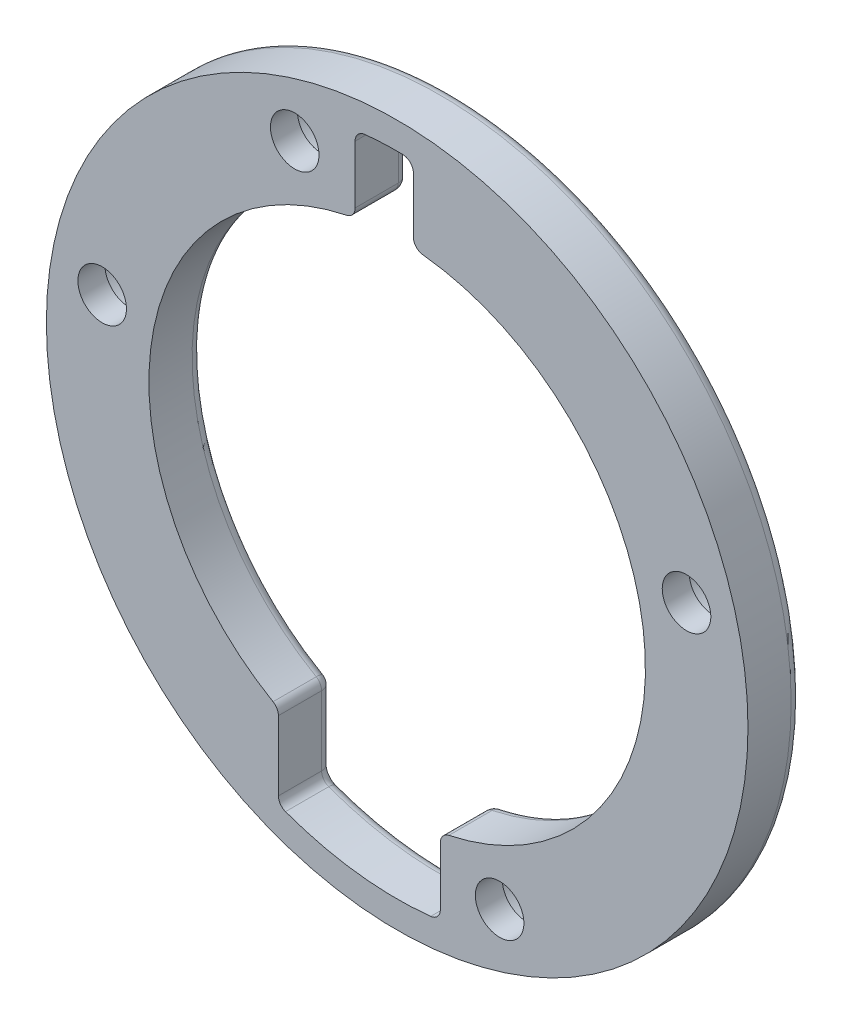
from build123d import *

# Parameters (mm, degrees)
SKETCH1_R                      = 32.5
BOSS_EXTRUDE1_DEPTH            = 5
CBORE_FOR_M4_SHCS1_D           = 4.5
CBORE_FOR_M4_SHCS1_CBORE_D     = 8.5
CBORE_FOR_M4_SHCS1_CBORE_DEPTH = 2.5
FILLET2_R                      = 1
FILLET3_R                      = 1


with BuildPart() as part:
    # Sketch1 → Boss-Extrude1 (new body)
    # profile 1 of 3: a face of its own
    with BuildSketch(Plane.XY):
        Circle(SKETCH1_R)
        with BuildLine():
            ThreePointArc((23, -5.63e-15), (17.621010186706098, -14.78174549909448), (3.9999999999999916, -22.64950330581225))
            Line((4, -22.64950330581225), (4.000000000000002, -29.732137494637012))
            ThreePointArc((4.0000000000000036, -29.73213749463701), (-3.6165626901756736, -29.781210088040908), (-11, -27.910571473905726))
            ThreePointArc((-11, -27.910571473905726), (-23.481565178581636, -18.6712639305437), (-29.671263930543617, -4.429006295324187))
            Line((-29.671263930543613, -4.429006295324186), (-22.9928556845359, -0.5732254967333699))
            ThreePointArc((-22.992855684535897, -0.5732254967333679), (-17.771682573326455, 14.600249946933266), (-3.899999999999999, 22.6669362729064))
            Line((-3.9, 22.6669362729064), (-3.9, 29.74541981549428))
            ThreePointArc((-3.8999999999999995, 29.74541981549428), (-1.204897673941924, 29.975793927689868), (1.4999999999999982, 29.96247653315726))
            ThreePointArc((1.4999999999999982, 29.96247653315726), (16.28027637225523, 25.19826583800932), (26.69826583800923, 13.682200160902106))
            Line((26.69826583800923, 13.682200160902106), (20.626179210300915, 10.176479311851942))
            ThreePointArc((20.626179210300908, 10.17647931185194), (22.398684356864813, 5.2248386655991155), (23, 0))
        make_face(mode=Mode.SUBTRACT)
    # profile 2 of 3: a face of its own
    with BuildSketch(Plane.XY):
        with BuildLine():
            ThreePointArc((1.4999999999999991, 22.951034835057), (12.774555523205114, 19.126179210300986), (20.626179210300908, 10.17647931185194))
            Line((20.626179210300915, 10.176479311851942), (26.69826583800923, 13.682200160902106))
            ThreePointArc((26.69826583800923, 13.682200160902106), (16.28027637225523, 25.19826583800932), (1.4999999999999982, 29.96247653315726))
            Line((1.5, 29.962476533157268), (1.5, 22.951034835057))
        make_face()
    # profile 3 of 3: a face of its own
    with BuildSketch(Plane.XY):
        with BuildLine():
            Line((-10.999999999999998, -27.910571473905723), (-11, -20.199009876724155))
            ThreePointArc((-11.000000000000004, -20.19900987672415), (-19.62578437999088, -11.992855684535943), (-22.992855684535897, -0.5732254967333679))
            Line((-22.9928556845359, -0.5732254967333699), (-29.671263930543613, -4.429006295324186))
            ThreePointArc((-29.671263930543617, -4.429006295324187), (-23.481565178581636, -18.6712639305437), (-11, -27.910571473905726))
        make_face()
    extrude(amount=-BOSS_EXTRUDE1_DEPTH)

    # CBORE for M4 SHCS1 (through all)
    with Locations(Plane(origin=(0, 0, -5), x_dir=(-1, 0, 0), z_dir=(0, 0, -1))):
        with Locations((27.328415146, 4.81873693), (9.491058977, 26.076470227), (-26.80444168, 7.182228502), (-9.491058977, -26.076470227)):
            CounterBoreHole(CBORE_FOR_M4_SHCS1_D / 2, CBORE_FOR_M4_SHCS1_CBORE_D / 2, CBORE_FOR_M4_SHCS1_CBORE_DEPTH)

    # Fillet2
    fillet2_edges = [part.edges().sort_by_distance(p)[0] for p in [
        (4.0000000000000036, -29.732137494637012, -2.5),
        (3.9999999999999947, -22.649503305812253, -2.5),
        (1.4999999999999996, 22.951034835057, -2.5),
        (1.4999999999999982, 29.96247653315727, -2.5),
        (-3.8999999999999995, 29.74541981549428, -2.5),
        (-3.9000000000000004, 22.666936272906405, -2.5),
        (-11.000000000000002, -20.199009876724155, -2.5),
        (-11, -27.910571473905723, -2.5),
    ]]
    fillet(fillet2_edges, radius=FILLET2_R)

    # Fillet3
    # the kernel refuses this fillet: 1 mm, written as the material it takes off along each edge
    with BuildSketch(Plane(origin=(0, 0, -5), x_dir=(1, 0, 0), z_dir=(0, -1, 0))) as fillet3_piece_1:
        with BuildLine():
            CenterArc((32.5 - FILLET3_R, FILLET3_R), FILLET3_R, 270, 90)
            Line((32.5 - FILLET3_R, 0), (32.5, 0))
            Line((32.5, 0), (32.5, FILLET3_R))
        make_face()
    revolve(axis=Axis((0, 0, -5), (0, 0, 1)), mode=Mode.SUBTRACT)
    with BuildSketch(Plane(origin=(-10.999999999999998, -27.22131517763241, -5), x_dir=(0, 0, 1), z_dir=(-2.3e-16, 1, 0))) as fillet3_piece_2:
        with BuildLine():
            CenterArc((FILLET3_R, -FILLET3_R), FILLET3_R, 90, 90)
            Line((0, -FILLET3_R), (0, 0))
            Line((0, 0), (FILLET3_R, 0))
        make_face()
    extrude(amount=6.436705486805881, mode=Mode.SUBTRACT)
    with BuildSketch(Plane(origin=(0, 8.9e-16, -5), x_dir=(-0.20416666666666677, 0.9789361430768722, 0), z_dir=(0.9789361430768722, 0.20416666666666677, 0))) as fillet3_piece_3:
        with BuildLine():
            CenterArc((23.000000000000007 + FILLET3_R, FILLET3_R), FILLET3_R, 180, 90.00000000000023)
            Line((23.000000000000007 + FILLET3_R, 0), (23.000000000000007, 0))
            Line((23.000000000000007, 0), (23.000000000000004, FILLET3_R))
        make_face()
    revolve(axis=Axis((0, 8.9e-16, -5), (0, 0, 1)), revolution_arc=138.21927913591307, mode=Mode.SUBTRACT)
    with BuildSketch(Plane(origin=(-3.354e-14, -2.2382e-13, -5), x_dir=(0.10344827586207093, -0.9946348346107555, 0), z_dir=(0.9946348346107555, 0.10344827586207093, 0))) as fillet3_piece_4:
        with BuildLine():
            CenterArc((29.999999999999787 + FILLET3_R, -FILLET3_R), FILLET3_R, 90, 90)
            Line((29.999999999999787 + FILLET3_R, 0), (29.999999999999787, 0))
            Line((29.999999999999787, 0), (29.999999999999787, -FILLET3_R))
        make_face()
    revolve(axis=Axis((-3.354e-14, -2.2382e-13, -5), (0, 0, -1)), revolution_arc=26.1090437980706, mode=Mode.SUBTRACT)
    with BuildSketch(Plane(origin=(4, -23.47338918861092, -5), x_dir=(0, 0, 1), z_dir=(2.5e-16, -1, 0))) as fillet3_piece_5:
        with BuildLine():
            CenterArc((FILLET3_R, -FILLET3_R), FILLET3_R, 90, 90)
            Line((0, -FILLET3_R), (0, 0))
            Line((0, 0), (FILLET3_R, 0))
        make_face()
    extrude(amount=5.371021015100997, mode=Mode.SUBTRACT)
    with BuildSketch(Plane(origin=(8.527e-14, 1.554e-14, -5), x_dir=(0.2083333333333306, -0.9780578828587924, 0), z_dir=(-0.9780578828587924, -0.2083333333333306, 0))) as fillet3_piece_6:
        with BuildLine():
            CenterArc((22.99999999999991 + FILLET3_R, FILLET3_R), FILLET3_R, 180, 89.99999999999977)
            Line((22.99999999999991 + FILLET3_R, 0), (22.99999999999991, 0))
            Line((22.99999999999991, 0), (22.999999999999915, FILLET3_R))
        make_face()
    revolve(axis=Axis((8.527e-14, 1.554e-14, -5), (0, 0, 1)), revolution_arc=161.9961440231332, mode=Mode.SUBTRACT)
    with BuildSketch(Plane(origin=(1.5, 28.995689334795948, -5), x_dir=(0, 0, 1), z_dir=(0, -1, 0))) as fillet3_piece_7:
        with BuildLine():
            CenterArc((FILLET3_R, -FILLET3_R), FILLET3_R, 90, 90)
            Line((0, -FILLET3_R), (0, 0))
            Line((0, 0), (FILLET3_R, 0))
        make_face()
    extrude(amount=5.126252810235989, mode=Mode.SUBTRACT)
    with BuildSketch(Plane(origin=(4.546e-14, -1.62004e-12, -5), x_dir=(-0.09999999999999602, 0.9949874371066204, 0), z_dir=(-0.9949874371066204, -0.09999999999999602, 0))) as fillet3_piece_8:
        with BuildLine():
            CenterArc((30.000000000001613 + FILLET3_R, -FILLET3_R), FILLET3_R, 90, 90)
            Line((30.000000000001613 + FILLET3_R, 0), (30.000000000001613, 0))
            Line((30.000000000001613, 0), (30.000000000001613, -FILLET3_R))
        make_face()
    revolve(axis=Axis((4.546e-14, -1.62004e-12, -5), (0, 0, -1)), revolution_arc=6.727077693922609, mode=Mode.SUBTRACT)
    with BuildSketch(Plane(origin=(-3.9, 23.494467433844935, -5), x_dir=(-4.4e-16, 0, 1), z_dir=(0, 1, 0))) as fillet3_piece_9:
        with BuildLine():
            CenterArc((FILLET3_R, -FILLET3_R), FILLET3_R, 90.00000000000003, 89.99999999999994)
            Line((4.4e-16, -FILLET3_R), (0, 0))
            Line((0, 0), (FILLET3_R, 0))
        make_face()
    extrude(amount=5.360168242247035, mode=Mode.SUBTRACT)
    with BuildSketch(Plane(origin=(-4.9, 23.49446743384493, -5), x_dir=(0.2041666666666649, -0.9789361430768725, 0), z_dir=(-0.9789361430768725, -0.2041666666666649, 0))) as fillet3_piece_10:
        with BuildLine():
            CenterArc((0.9999999999999997 - FILLET3_R, FILLET3_R), FILLET3_R, 270, 90)
            Line((0.9999999999999997 - FILLET3_R, 0), (0.9999999999999997, 0))
            Line((0.9999999999999997, 0), (0.9999999999999999, FILLET3_R))
        make_face()
    revolve(axis=Axis((-4.9, 23.49446743384493, -5), (0, 0, 1)), revolution_arc=78.2192791359134, mode=Mode.SUBTRACT)
    with BuildSketch(Plane(origin=(2.5, 23.86943652455996, -5), x_dir=(-0.10416666666666341, -0.9945598551900012, 0), z_dir=(0.9945598551900012, -0.10416666666666341, 0))) as fillet3_piece_11:
        with BuildLine():
            CenterArc((1 - FILLET3_R, -FILLET3_R), FILLET3_R, 0, 90)
            Line((1 - FILLET3_R, 0), (1, 0))
            Line((1, 0), (1, -FILLET3_R))
        make_face()
    revolve(axis=Axis((2.5, 23.86943652455996, -5), (0, 0, -1)), revolution_arc=84.02084320369887, mode=Mode.SUBTRACT)
    with BuildSketch(Plane(origin=(5.000000000000001, -23.47338918861092, -5), x_dir=(-1, 0, 0), z_dir=(0, -1, 0))) as fillet3_piece_12:
        with BuildLine():
            CenterArc((1 - FILLET3_R, -FILLET3_R), FILLET3_R, 0, 90)
            Line((1 - FILLET3_R, 0), (1, 0))
            Line((1, 0), (1, -FILLET3_R))
        make_face()
    revolve(axis=Axis((5.000000000000001, -23.47338918861092, -5), (0, 0, -1)), revolution_arc=77.97530081943442, mode=Mode.SUBTRACT)
    with BuildSketch(Plane(origin=(-12, -20.784609690826528, -5), x_dir=(1, 0, 0), z_dir=(0, -1, 0))) as fillet3_piece_13:
        with BuildLine():
            CenterArc((1 - FILLET3_R, FILLET3_R), FILLET3_R, 270, 90)
            Line((1 - FILLET3_R, 0), (1, 0))
            Line((1, 0), (1, FILLET3_R))
        make_face()
    revolve(axis=Axis((-12, -20.784609690826528, -5), (0, 0, 1)), revolution_arc=59.99999999999988, mode=Mode.SUBTRACT)
    with BuildSketch(Plane(origin=(-9.999999999999998, -27.221315177632405, -5), x_dir=(-0.34482758620689447, -0.9386660406080146, 0), z_dir=(0.9386660406080146, -0.34482758620689447, 0))) as fillet3_piece_14:
        with BuildLine():
            CenterArc((1.0000000000000018 + FILLET3_R, -FILLET3_R), FILLET3_R, 90, 90)
            Line((1.0000000000000018 + FILLET3_R, 0), (1.0000000000000018, 0))
            Line((1.0000000000000018, 0), (1.0000000000000018, -FILLET3_R))
        make_face()
    revolve(axis=Axis((-9.999999999999998, -27.221315177632405, -5), (0, 0, -1)), revolution_arc=69.82872865353495, mode=Mode.SUBTRACT)
    with BuildSketch(Plane(origin=(3.0000000000000013, -28.844410203711917, -5), x_dir=(1, 0, 0), z_dir=(0, 1, 0))) as fillet3_piece_15:
        with BuildLine():
            CenterArc((1.0000000000000004 + FILLET3_R, -FILLET3_R), FILLET3_R, 90, 90)
            Line((1.0000000000000004 + FILLET3_R, 0), (1.0000000000000004, 0))
            Line((1.0000000000000004, 0), (1.0000000000000004, -FILLET3_R))
        make_face()
    revolve(axis=Axis((3.0000000000000013, -28.844410203711917, -5), (0, 0, -1)), revolution_arc=84.06222754839449, mode=Mode.SUBTRACT)
    with BuildSketch(Plane(origin=(0.5, 28.995689334795948, -5), x_dir=(1, 0, 0), z_dir=(0, -1, 0))) as fillet3_piece_16:
        with BuildLine():
            CenterArc((1 + FILLET3_R, FILLET3_R), FILLET3_R, 180, 90)
            Line((1 + FILLET3_R, 0), (1, 0))
            Line((1, 0), (1, FILLET3_R))
        make_face()
    revolve(axis=Axis((0.5, 28.995689334795948, -5), (0, 0, 1)), revolution_arc=89.01209278334395, mode=Mode.SUBTRACT)
    with BuildSketch(Plane(origin=(-2.9, 28.85463567609197, -5), x_dir=(-0.09999999999999662, 0.9949874371066203, 0), z_dir=(0.9949874371066203, 0.09999999999999662, 0))) as fillet3_piece_17:
        with BuildLine():
            CenterArc((0.9999999999999991 + FILLET3_R, FILLET3_R), FILLET3_R, 180, 90)
            Line((0.9999999999999991 + FILLET3_R, 0), (0.9999999999999991, 0))
            Line((0.9999999999999991, 0), (0.9999999999999991, FILLET3_R))
        make_face()
    revolve(axis=Axis((-2.9, 28.85463567609197, -5), (0, 0, 1)), revolution_arc=84.26082952273342, mode=Mode.SUBTRACT)


solid = part.part
